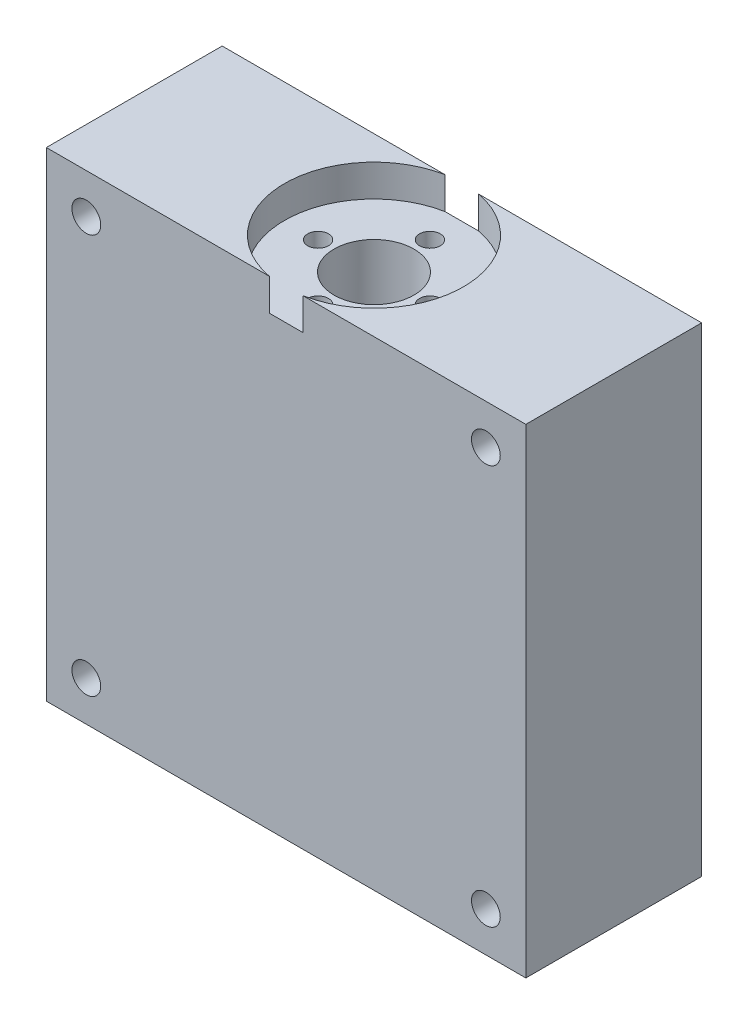
from build123d import *

# Parameters (mm, degrees)
SKETCH1_W           = 60
SKETCH1_H           = 60
SKETCH1_R           = 1.8
BOSS_EXTRUDE1_DEPTH = 22
SKETCH2_R           = 11.2
CUT_EXTRUDE1_DEPTH  = 4
CUT_EXTRUDE2_REACH  = 69.231
SKETCH3_R           = 5
SKETCH4_R           = 7.2
CUT_EXTRUDE3_DEPTH  = 46
SKETCH5_R           = 1.3
CUT_EXTRUDE4_DEPTH  = 6


with BuildPart() as part:
    # Sketch1 → Boss-Extrude1 (new body)
    with BuildSketch(Plane.XY):
        Rectangle(SKETCH1_W, SKETCH1_H)
        with Locations((-25, 25)):
            Circle(SKETCH1_R, mode=Mode.SUBTRACT)
        with Locations((25, 25)):
            Circle(SKETCH1_R, mode=Mode.SUBTRACT)
        with Locations((25, -25)):
            Circle(SKETCH1_R, mode=Mode.SUBTRACT)
        with Locations((-25, -25)):
            Circle(SKETCH1_R, mode=Mode.SUBTRACT)
    extrude(amount=BOSS_EXTRUDE1_DEPTH)

    # Sketch2 → Cut-Extrude1 (cut)
    with BuildSketch(Plane(origin=(0, 30, 0), x_dir=(1, 0, 0), z_dir=(0, 1, 0))):
        with Locations((0, -11)):
            Circle(SKETCH2_R)
    extrude(amount=-CUT_EXTRUDE1_DEPTH, mode=Mode.SUBTRACT)

    # Sketch3 → Cut-Extrude2 (cut, up to next)
    with BuildSketch(Plane(origin=(0, 26, 0), x_dir=(1, 0, 0), z_dir=(0, 1, 0)), mode=Mode.PRIVATE) as cut_extrude2_sk1:
        with Locations((0, -11)):
            Circle(SKETCH3_R)
    cut_extrude2_tool1 = extrude(cut_extrude2_sk1.sketch, amount=-CUT_EXTRUDE2_REACH, mode=Mode.PRIVATE) & part.part
    add(cut_extrude2_tool1.solids().sort_by_distance((0, 26, 11))[0], mode=Mode.SUBTRACT)

    # Sketch4 → Cut-Extrude3 (cut)
    with BuildSketch(Plane.XZ.offset(30)):
        with Locations((0, 11)):
            Circle(SKETCH4_R)
    extrude(amount=-CUT_EXTRUDE3_DEPTH, mode=Mode.SUBTRACT)

    # Sketch5 → Cut-Extrude4 (cut)
    with BuildSketch(Plane(origin=(0, 26, 0), x_dir=(1, 0, 0), z_dir=(0, 1, 0))):
        with Locations((0, -4)):
            Circle(SKETCH5_R)
        with Locations((7, -11)):
            Circle(SKETCH5_R)
        with Locations((0, -18)):
            Circle(SKETCH5_R)
        with Locations((-7, -11)):
            Circle(SKETCH5_R)
    extrude(amount=-CUT_EXTRUDE4_DEPTH, mode=Mode.SUBTRACT)


solid = part.part
